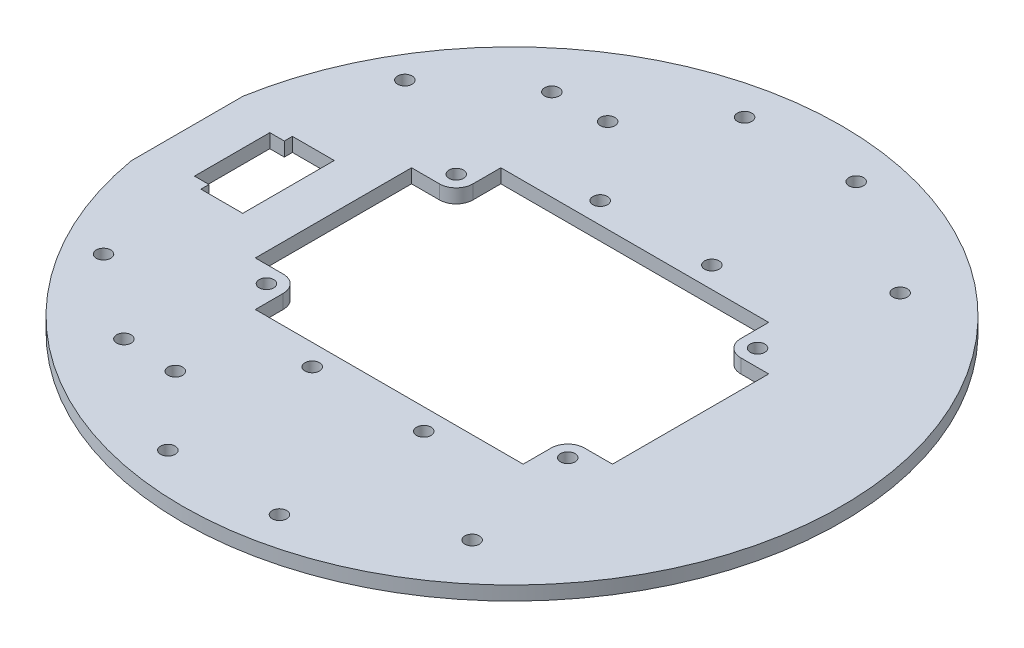
from build123d import *

# Parameters (mm, degrees)
SKETCH1_R           = 1.651
BOSS_EXTRUDE1_DEPTH = 3.175


with BuildPart() as part:
    # Sketch1 → Boss-Extrude1 (new body)
    with BuildSketch(Plane(origin=(0, 0, 0), x_dir=(1, 0, 0), z_dir=(0, 1, 0))):
        with BuildLine():
            Line((-73.916912814, 12.7), (-73.916912814, -12.7))
            ThreePointArc((-73.916912814, -12.7), (75, 0), (-73.916912814, 12.7))
        make_face()
        with Locations((-34.29, 21.59)):
            Circle(SKETCH1_R, mode=Mode.SUBTRACT)
        with Locations((34.29, 21.59)):
            Circle(SKETCH1_R, mode=Mode.SUBTRACT)
        with Locations((-34.29, -21.59)):
            Circle(SKETCH1_R, mode=Mode.SUBTRACT)
        with Locations((34.29, -21.59)):
            Circle(SKETCH1_R, mode=Mode.SUBTRACT)
        with Locations((39.626912814, -48.698461806)):
            Circle(SKETCH1_R, mode=Mode.SUBTRACT)
        with Locations((-39.626912814, -48.698461806)):
            Circle(SKETCH1_R, mode=Mode.SUBTRACT)
        with Locations((-58.676912814, -34.29)):
            Circle(SKETCH1_R, mode=Mode.SUBTRACT)
        with Locations((-58.676912814, 34.29)):
            Circle(SKETCH1_R, mode=Mode.SUBTRACT)
        with Locations((-39.626912814, 48.698461806)):
            Circle(SKETCH1_R, mode=Mode.SUBTRACT)
        with Locations((39.626912814, 48.698461806)):
            Circle(SKETCH1_R, mode=Mode.SUBTRACT)
        with Locations((12.7, -65.623435955)):
            Circle(SKETCH1_R, mode=Mode.SUBTRACT)
        with Locations((12.7, -32.773435955)):
            Circle(SKETCH1_R, mode=Mode.SUBTRACT)
        with Locations((12.7, 32.773435955)):
            Circle(SKETCH1_R, mode=Mode.SUBTRACT)
        with Locations((12.7, 65.623435955)):
            Circle(SKETCH1_R, mode=Mode.SUBTRACT)
        with Locations((-27.425, -49.198435955)):
            Circle(SKETCH1_R, mode=Mode.SUBTRACT)
        with Locations((-12.7, -32.773435955)):
            Circle(SKETCH1_R, mode=Mode.SUBTRACT)
        with Locations((-12.7, -65.623435955)):
            Circle(SKETCH1_R, mode=Mode.SUBTRACT)
        with Locations((-12.7, 65.623435955)):
            Circle(SKETCH1_R, mode=Mode.SUBTRACT)
        with Locations((-27.425, 49.198435955)):
            Circle(SKETCH1_R, mode=Mode.SUBTRACT)
        with Locations((-12.7, 32.773435955)):
            Circle(SKETCH1_R, mode=Mode.SUBTRACT)
        with BuildLine():
            Line((-30.48, 27.94), (30.48, 27.94))
            Line((30.48, 27.94), (30.48, 21.59))
            ThreePointArc((30.48, 21.59), (31.595923164, 18.895923164), (34.29, 17.78))
            Line((34.29, 17.78), (40.64, 17.78))
            Line((40.64, 17.78), (40.64, -17.78))
            Line((40.64, -17.78), (34.29, -17.78))
            ThreePointArc((34.29, -17.78), (31.595923164, -18.895923164), (30.48, -21.59))
            Line((30.48, -21.59), (30.48, -27.94))
            Line((30.48, -27.94), (-30.48, -27.94))
            Line((-30.48, -27.94), (-30.48, -21.59))
            ThreePointArc((-30.48, -21.59), (-31.595923164, -18.895923164), (-34.29, -17.78))
            Line((-34.29, -17.78), (-40.64, -17.78))
            Line((-40.64, -17.78), (-40.64, 17.78))
            Line((-40.64, 17.78), (-34.29, 17.78))
            ThreePointArc((-34.29, 17.78), (-31.595923164, 18.895923164), (-30.48, 21.59))
            Line((-30.48, 21.59), (-30.48, 27.94))
        make_face(mode=Mode.SUBTRACT)
        Polygon((-63.691956407, 8.5725), (-60.389956407, 8.5725), (-60.389956407, 10.414), (-50.864956407, 10.414), (-50.864956407, 8.5725), (-50.864956407, -8.5725), (-50.864956407, -10.414), (-60.389956407, -10.414), (-60.389956407, -8.5725), (-63.691956407, -8.5725), align=None, mode=Mode.SUBTRACT)
    extrude(amount=BOSS_EXTRUDE1_DEPTH)


solid = part.part
